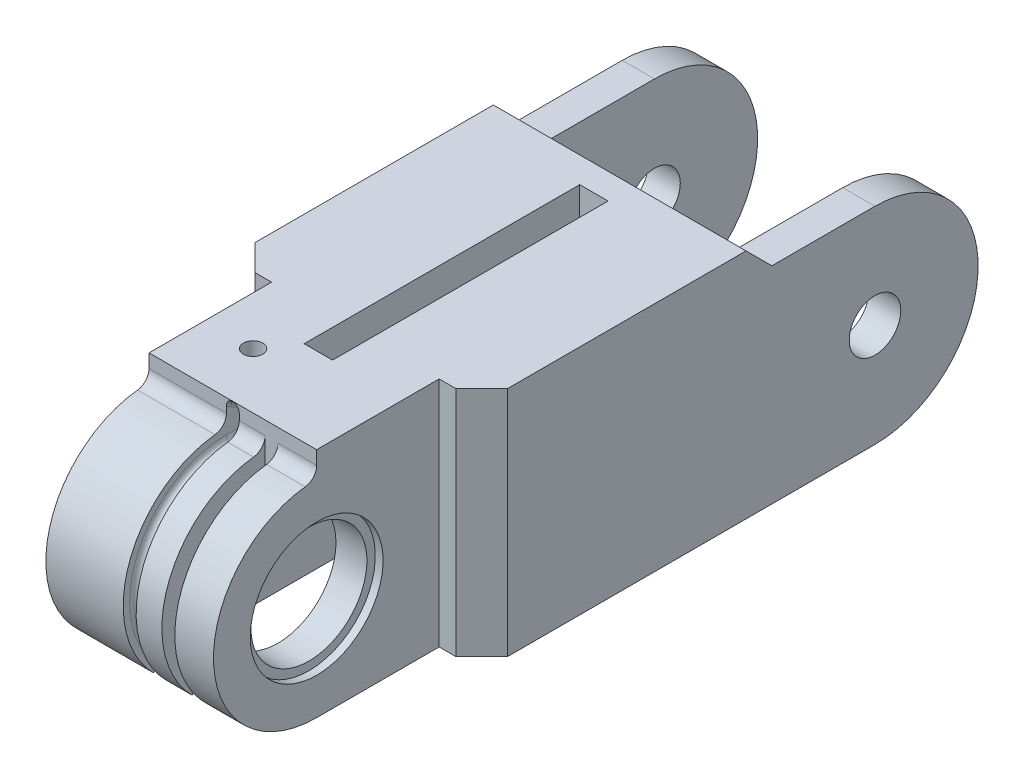
from build123d import *
from build123d.topology import SkipClean

# Parameters (mm, degrees)
BOSS_EXTRU_1_START      = 3.5
ESQUISSE1_R             = 2
BOSS_EXTRU_1_DEPTH      = 3
BOSS_EXTRU_2_START      = 6.5
BOSS_EXTRU_2_DEPTH      = 3.3
BOSS_EXTRU_5_START      = 7.3
ESQUISSE1_12_R          = 2
BOSS_EXTRU_5_DEPTH      = 2.5
BOSS_EXTRU_3_DEPTH      = 6.5
BOSS_EXTRU_4_START      = 0.5
BOSS_EXTRU_4_DEPTH      = 6
CONG_4_R                = 12
FILLET1_R               = 0.5
FILLET2_R               = 1
CHAMFER1_SIZE           = 2
ENL_V_START             = 3.5
ESQUISSE2_W             = 8
ESQUISSE2_H             = 18
ENL_V_MAT_EXTRU_1_DEPTH = 1
ENL_V_MAT_EXTRU_3_REACH = 52
ESQUISSE4_R             = 0.75
ESQUISSE5_W             = 21.366750419
ESQUISSE5_H             = 3.6
ENL_V_MAT_EXTRU_4_DEPTH = 1.1
CONG_5_R                = 1.1
ENL_V_MAT_EXTRU_5_REACH = 54.192
ESQUISSE12_R            = 0.75


# Some blends are built 0.0001 mm under size
with BuildPart() as part:
    # Esquisse1 → Boss.-Extru.1 (new body)
    with BuildSketch(Plane(origin=(0, 0, 0), x_dir=(0, 0, -1), z_dir=(1, 0, 0)).offset(BOSS_EXTRU_1_START)):
        with BuildLine():
            Line((30, 10), (0, 10))
            Line((0, 10), (0, 8))
            ThreePointArc((0, 8), (-8, 0), (0, -8))
            Line((0, -8), (30.291756081, -8))
            Line((30.291756081, -8), (30.291756081, 0))
            ThreePointArc((30.291756081, 0), (30.728647581, 2.879587526), (32, 5.5))
            Line((32, 5.5), (32, 8))
            Line((32, 8), (30, 10))
        make_face()
        Circle(ESQUISSE1_R, mode=Mode.SUBTRACT)
    extrude(amount=BOSS_EXTRU_1_DEPTH)

    # Esquisse1<8> → Boss.-Extru.2 (add)
    with BuildSketch(Plane(origin=(0, 0, 0), x_dir=(0, 0, -1), z_dir=(1, 0, 0)).offset(BOSS_EXTRU_2_START)):
        with BuildLine():
            Line((30, 10), (9.5, 10))
            Line((9.5, 10), (9.5, -8))
            Line((9.5, -8), (30.291756081, -8))
            Line((30.291756081, -8), (30.291756081, 0))
            ThreePointArc((30.291756081, 0), (30.728647581, 2.879587526), (32, 5.5))
            Line((32, 5.5), (32, 8))
            Line((32, 8), (30, 10))
        make_face()
    extrude(amount=BOSS_EXTRU_2_DEPTH)

    # Esquisse1<12> → Boss.-Extru.5 (add)
    with BuildSketch(Plane(origin=(0, 0, 0), x_dir=(0, 0, -1), z_dir=(1, 0, 0)).offset(BOSS_EXTRU_5_START)):
        with BuildLine():
            Line((40, 8), (32, 8))
            Line((32, 8), (32, 7))
            Line((32, 7), (32, 5.5))
            ThreePointArc((32, 5.5), (30.728647581, 2.879587526), (30.291756081, 0))
            Line((30.291756081, 0), (30.291756081, -8))
            Line((30.291756081, -8), (40, -8))
            ThreePointArc((40, -8), (48, 0), (40, 8))
        make_face()
        with Locations((40, 0)):
            Circle(ESQUISSE1_12_R, mode=Mode.SUBTRACT)
    extrude(amount=BOSS_EXTRU_5_DEPTH)

    # Esquisse1<9> → Boss.-Extru.3 (add)
    with BuildSketch(Plane(origin=(0, 0, 0), x_dir=(0, 0, -1), z_dir=(1, 0, 0))):
        with BuildLine():
            Line((0, 10), (2, 8))
            Line((2, 8), (28, 8))
            ThreePointArc((28, 8), (29.530733729, 8.30448187), (30.828427125, 9.171572875))
            Line((30.828427125, 9.171572875), (30, 10))
            Line((30, 10), (0, 10))
        make_face()
        with BuildLine():
            Line((0, 5.5), (28.791756081, 5.5))
            Line((28.791756081, 5.5), (28.791756081, -8))
            Line((28.791756081, -8), (30.291756081, -8))
            Line((30.291756081, -8), (30.291756081, 0))
            ThreePointArc((30.291756081, 0), (30.728647581, 2.879587526), (32, 5.5))
            Line((32, 5.5), (32, 7))
            Line((32, 7), (0, 7))
            ThreePointArc((0, 7), (-6.467156728, 2.678784027), (-4.949747468, -4.949747468))
            Line((-4.949747468, -4.949747468), (-3.889087297, -3.889087297))
            ThreePointArc((-3.889087297, -3.889087297), (-5.081337429, 2.104758878), (0, 5.5))
        make_face()
    extrude(amount=BOSS_EXTRU_3_DEPTH)

    # Esquisse1<10> → Boss.-Extru.4 (add)
    with BuildSketch(Plane(origin=(0, 0, 0), x_dir=(0, 0, -1), z_dir=(1, 0, 0)).offset(BOSS_EXTRU_4_START)):
        with BuildLine():
            Line((2, 8), (0, 10))
            Line((0, 10), (0, 8))
            ThreePointArc((0, 8), (-7.39103626, 3.061467459), (-5.656854249, -5.656854249))
            Line((-5.656854249, -5.656854249), (-4.949747468, -4.949747468))
            ThreePointArc((-4.949747468, -4.949747468), (-6.467156728, 2.678784027), (0, 7))
            Line((0, 7), (32, 7))
            Line((32, 7), (32, 8))
            Line((32, 8), (30.828427125, 9.171572875))
            ThreePointArc((30.828427125, 9.171572875), (29.530733729, 8.30448187), (28, 8))
            Line((28, 8), (2, 8))
        make_face()
    extrude(amount=BOSS_EXTRU_4_DEPTH)

    # Congé4
    # the kernel refuses this fillet: 12 mm, written as the material it takes off along each edge
    with BuildSketch(Plane(origin=(-11.583123952, 8, -2), x_dir=(0, 0, -1), z_dir=(1, 0, 0))) as cong_4_piece_1:
        with BuildLine():
            CenterArc((4.633249581, 12), CONG_4_R, 236.442690238, 33.557309762)
            Line((-2, 2), (-2.132664992, 1.8))
            ThreePointArc((-2.132664992, 1.8), (-1.169705627, 0.830294373), (-0.169705627, -0.169705627))
            Line((-0.169705627, -0.169705627), (0, -0.24))
            Line((0, -0.24), (4.633249581, -0.24))
            Line((4.633249581, -0.24), (4.633249581, 0))
        make_face()
    extrude(amount=12.083123952, mode=Mode.SUBTRACT)

    # Fillet1
    # the kernel refuses this fillet: 0.5 mm, written as the material it adds along each edge
    with BuildSketch(Plane(origin=(0.5, 20, -6.633249581), x_dir=(0, -0.7713363788823462, 0.6364276790120538), z_dir=(0, 0.6364276790120538, 0.7713363788823462))) as fillet1_piece_1_section:
        with BuildLine():
            CenterArc((12 + FILLET1_R, -FILLET1_R), FILLET1_R, 90, 90)
            Line((12 + FILLET1_R, 0), (12, 0))
            Line((12, 0), (12, -FILLET1_R))
        make_face()
    fillet1_piece_1 = revolve(axis=Axis((0.5, 20, -6.633249581), (1, 0, 0)), revolution_arc=39.525953359, mode=Mode.PRIVATE)
    fillet1_piece_1 = split(fillet1_piece_1, bisect_by=Plane(origin=(0.358961784, 10, -3.12843374), z_dir=(0, -1, 0)), keep=Keep.TOP, mode=Mode.PRIVATE)
    fillet1_piece_1 = split(fillet1_piece_1, bisect_by=Plane(origin=(0.358961784, 8.375840896, 0), z_dir=(0, 0, -1)), keep=Keep.TOP, mode=Mode.PRIVATE)
    add(fillet1_piece_1)
    with BuildSketch(Plane(origin=(0.5, 8, -28), x_dir=(-1, 0, 0), z_dir=(0, 0, 1))) as fillet1_piece_2:
        with BuildLine():
            CenterArc((FILLET1_R, FILLET1_R), FILLET1_R, 180, 90)
            Line((0, FILLET1_R), (0, 0))
            Line((0, 0), (FILLET1_R, 0))
        make_face()
    extrude(amount=21.366750419)
    with BuildSketch(Plane(origin=(0.5, 7, 0), x_dir=(-1, 0, 0), z_dir=(0, 0, -1))) as fillet1_piece_3:
        with BuildLine():
            CenterArc((FILLET1_R, FILLET1_R), FILLET1_R, 180, 90)
            Line((0, FILLET1_R), (0, 0))
            Line((0, 0), (FILLET1_R, 0))
        make_face()
    extrude(amount=32)
    with BuildSketch(Plane(origin=(0.5, 0, 0), x_dir=(0, -0.7071067811865441, 0.7071067811865509), z_dir=(0, -0.7071067811865509, -0.7071067811865441))) as fillet1_piece_4:
        with BuildLine():
            CenterArc((7 + FILLET1_R, FILLET1_R), FILLET1_R, 180, 90)
            Line((7 + FILLET1_R, 0), (7, 0))
            Line((7, 0), (7, FILLET1_R))
        make_face()
    revolve(axis=Axis((0.5, 0, 0), (-1, 0, 0)), revolution_arc=135)
    with BuildSketch(Plane(origin=(0.5, 12, -28), x_dir=(0, -0.7071067811865426, -0.7071067811865523), z_dir=(0, 0.7071067811865523, -0.7071067811865426))) as fillet1_piece_5:
        with BuildLine():
            CenterArc((4 + FILLET1_R, FILLET1_R), FILLET1_R, 180, 90)
            Line((4 + FILLET1_R, 0), (4, 0))
            Line((4, 0), (4, FILLET1_R))
        make_face()
    revolve(axis=Axis((0.5, 12, -28), (-1, 0, 0)), revolution_arc=45)

    # Fillet2
    fillet2_edges = [part.edges().sort_by_distance(p)[0] for p in [
        (3.5, 8, 0),
    ]]
    fillet(fillet2_edges, radius=FILLET2_R)

    # Chamfer1
    chamfer1_edges = [part.edges().sort_by_distance(p)[0] for p in [
        (9.8, 1, -9.5),
    ]]
    chamfer(chamfer1_edges, length=CHAMFER1_SIZE)

    # Symétrie1: part across plane


with BuildPart() as part_1:
    add(part.part)
    add(part.part.mirror(Plane(origin=(0, 0, 0), x_dir=(0, 0, 1), z_dir=(1, 0, 0))))

    # Esquisse2 → Enlèv. mat.-Extru.1 (cut)
    with SkipClean():  # the faces are left unmerged after this step: merging them gives an invalid solid
        with BuildSketch(Plane(origin=(0, 0, 0), x_dir=(0, 0, -1), z_dir=(1, 0, 0)).offset(ENL_V_START)):
            with Locations((-4, 1)):
                Rectangle(ESQUISSE2_W, ESQUISSE2_H)
        extrude(amount=-ENL_V_MAT_EXTRU_1_DEPTH, mode=Mode.SUBTRACT)

    # Esquisse4 → Enlèv. mat.-Extru.3 (cut, up to next)
    with BuildSketch(Plane.XY, mode=Mode.PRIVATE) as enl_v_mat_extru_3_sk1:
        with Locations((2.75, -3.8608)):
            Circle(ESQUISSE4_R)
    enl_v_mat_extru_3_tool1 = extrude(enl_v_mat_extru_3_sk1.sketch, amount=-ENL_V_MAT_EXTRU_3_REACH, mode=Mode.PRIVATE) & part_1.part
    add(enl_v_mat_extru_3_tool1.solids().sort_by_distance((2.75, -3.8608, 0))[0], mode=Mode.SUBTRACT)

    # Esquisse5 → Enlèv. mat.-Extru.4 (cut, symmetric)
    with SkipClean():  # the faces are left unmerged after this step: merging them gives an invalid solid
        with BuildSketch(Plane(origin=(0, 0, 0), x_dir=(0, 0, -1), z_dir=(1, 0, 0))):
            with Locations((17.316624791, 8.2)):
                Rectangle(ESQUISSE5_W, ESQUISSE5_H)
        extrude(amount=ENL_V_MAT_EXTRU_4_DEPTH, both=True, mode=Mode.SUBTRACT)

    # Congé5
    cong_5_edges = [part_1.edges().sort_by_distance(p)[0] for p in [
        (1.1, 6.4, -17.31662479),
        (-1.1, 6.4, -17.31662479),
    ]]
    fillet(cong_5_edges, radius=CONG_5_R - 0.0001)  # a hair under: the kernel refuses the full size

    # Esquisse10 → Enlèvement de matière-Révolution1 (revolve, cut)
    with BuildSketch(Plane.XY, mode=Mode.PRIVATE) as enl_vement_de_mati_re_r_volution1_sk:
        Polygon((-6.5, 5.15), (-5.9, 5.15), (-5.9, 4.5), (5.9, 4.5), (5.9, 5.15), (6.5, 5.15), (6.5, 2), (-6.5, 2), align=None)
    revolve(enl_vement_de_mati_re_r_volution1_sk.sketch.rotate(Axis((-6.5, 0, 0), (1, 0, 0)), 90), axis=Axis((-6.5, 0, 0), (1, 0, 0)), mode=Mode.SUBTRACT)

    # Esquisse12 → Enlèv. mat.-Extru.5 (cut, up to next)
    with BuildSketch(Plane(origin=(0, 10, 0), x_dir=(1, 0, 0), z_dir=(0, 1, 0)), mode=Mode.PRIVATE) as enl_v_mat_extru_5_sk1:
        with Locations(Location((-2.75, 4.322277882, 0), (0, 0, 270))):
            Circle(ESQUISSE12_R)
    enl_v_mat_extru_5_tool1 = extrude(enl_v_mat_extru_5_sk1.sketch, amount=-ENL_V_MAT_EXTRU_5_REACH, mode=Mode.PRIVATE) & part_1.part
    add(enl_v_mat_extru_5_tool1.solids().sort_by_distance((-2.75, 10, -4.322278))[0], mode=Mode.SUBTRACT)


solid = part_1.part
